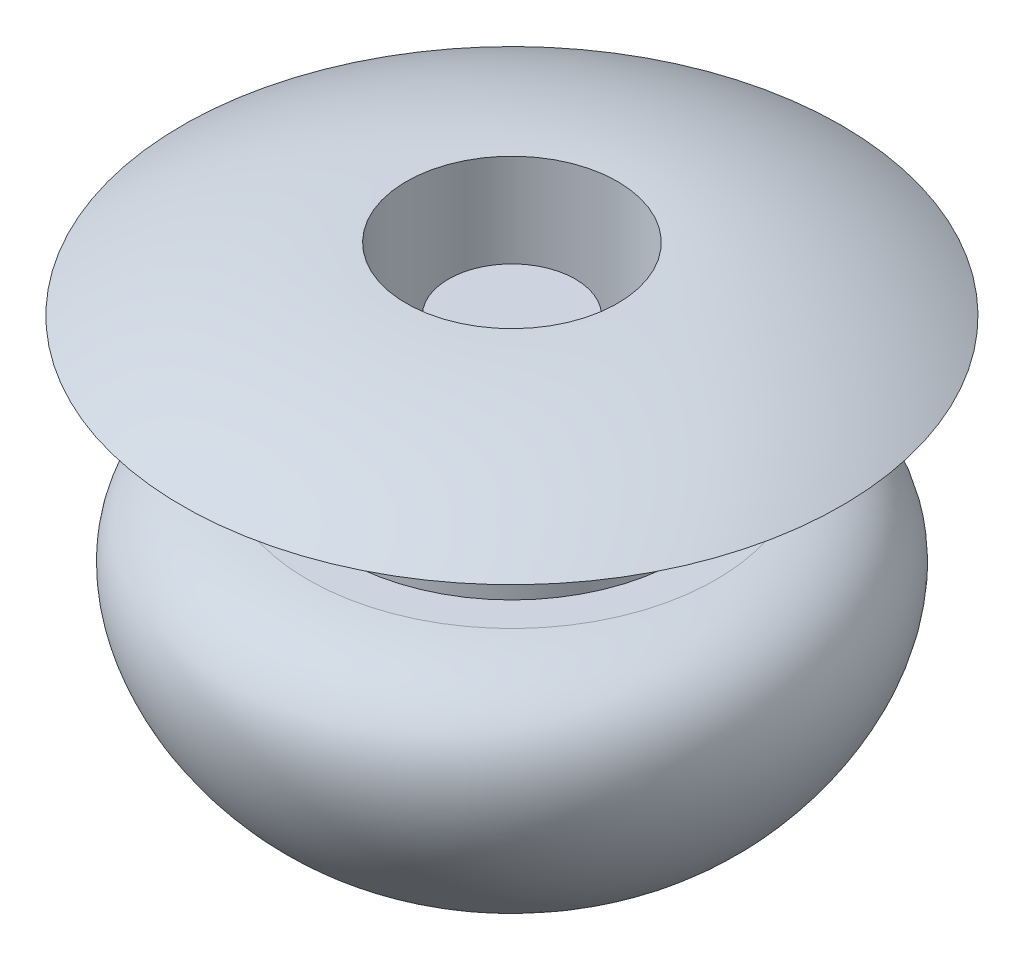
from build123d import *


with BuildPart() as part:
    # Szkic1 → Obrót1 (revolve)
    with BuildSketch(Plane(origin=(0, 0, 0), x_dir=(0, 0, -1), z_dir=(1, 0, 0))):
        with BuildLine():
            Line((0, 0), (-0.75, 0))
            Line((-0.75, 0), (-0.75, -1.70072744))
            Line((-0.75, -1.70072744), (-1.25, -1.70072744))
            Line((-1.25, -1.70072744), (-1.25, 0.75))
            ThreePointArc((-1.25, 0.75), (-2.627043935, 0.558888572), (-3.9, 0))
            Line((-3.9, 0), (-2, 0))
            Line((-2, 0), (-2, -1.499988917))
            Line((-2, -1.499988917), (-2.413891755, -1.499988917))
            add(Edge.make_bspline(
                [(-2.413891755, -1.499988917), (-3.867503112, -1.669646239), (-3.528877649, -3.802002543), (-1.083961642, -5.373521286), (-0.271752618, -3.374938215), (-0.956030427, -3.07891811)],
                knots=[0, 0, 0, 0, 0.464993082, 0.721927553, 1, 1, 1, 1], degree=3))
            add(Edge.make_bspline(
                [(-0.956030427, -3.07891811), (-0.520263876, -3.20072744), (0, -3.20072744)],
                knots=[0.992852221, 0.992852221, 0.992852221, 1.570796327, 1.570796327, 1.570796327], degree=2, weights=[1, 0.958537313, 1]))
            Line((0, -3.20072744), (0, -1.70072744))
            Line((0, -1.70072744), (0, 0))
        make_face()
    revolve(axis=Axis((0, 0, 0), (0, 1, 0)))


solid = part.part
